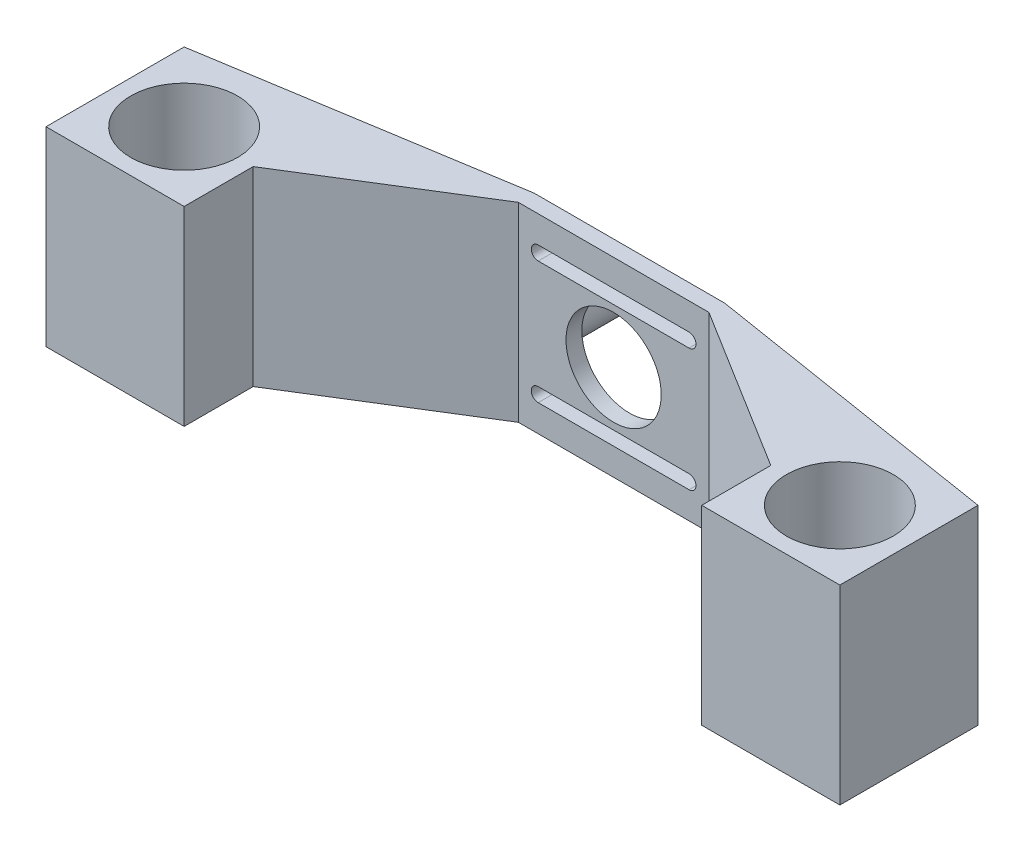
from build123d import *

# Parameters (mm, degrees)
SKETCH2_R           = 13.45
BOSS_EXTRUDE1_DEPTH = 48
SKETCH4_R           = 12
CUT_EXTRUDE1_DEPTH  = 48
SKETCH5_R           = 7.1
SKETCH5_R_2         = 4.1
BOSS_EXTRUDE2_DEPTH = 2
BOSS_EXTRUDE3_START = 13
SKETCH6_R           = 7.1
SKETCH6_R_2         = 4.1
BOSS_EXTRUDE3_DEPTH = 13


with BuildPart() as part:
    # Sketch2 → Boss-Extrude1 (new body)
    with BuildSketch(Plane(origin=(0, 0, 0), x_dir=(1, 0, 0), z_dir=(0, 1, 0))):
        Polygon((-17.4, -17.4), (17.4, -17.4), (17.4, 0), (58.6, 25.6), (82.6, 25.6), (82.6, 29.6), (58.6, 29.6), (-17.4, 17.4), align=None)
        Circle(SKETCH2_R, mode=Mode.SUBTRACT)
    boss_extrude1 = extrude(amount=BOSS_EXTRUDE1_DEPTH)

    # Mirror1: Boss-Extrude1 across plane
    add(boss_extrude1.mirror(Plane(origin=(82.6, 0, 0), x_dir=(0, 0, 1), z_dir=(1, 0, 0))))

    # Sketch4 → Cut-Extrude1 (cut)
    with BuildSketch(Plane(origin=(0, 0, -29.6), x_dir=(-1, 0, 0), z_dir=(0, 0, -1))):
        with Locations((-82.6, 24)):
            Circle(SKETCH4_R)
        with BuildLine():
            Line((-101.6, 10.3), (-63.6, 10.3))
            ThreePointArc((-63.6, 10.3), (-61.85, 8.55), (-63.6, 6.8))
            Line((-63.6, 6.8), (-101.6, 6.8))
            ThreePointArc((-101.6, 6.8), (-103.35, 8.55), (-101.6, 10.3))
        make_face()
        with BuildLine():
            Line((-101.6, 37.7), (-63.6, 37.7))
            ThreePointArc((-63.6, 37.7), (-61.85, 39.45), (-63.6, 41.2))
            Line((-63.6, 41.2), (-101.6, 41.2))
            ThreePointArc((-101.6, 41.2), (-103.35, 39.45), (-101.6, 37.7))
        make_face()
    extrude(amount=-CUT_EXTRUDE1_DEPTH, mode=Mode.SUBTRACT)

    # Sketch5 → Boss-Extrude2 (add)
    with BuildSketch(Plane(origin=(0, 0, -29.6), x_dir=(-1, 0, 0), z_dir=(0, 0, -1))):
        with Locations((-62.1, 24)):
            Circle(SKETCH5_R)
        with Locations((-62.1, 24)):
            Circle(SKETCH5_R_2, mode=Mode.SUBTRACT)
    extrude(amount=-BOSS_EXTRUDE2_DEPTH)

    # Sketch6 → Boss-Extrude3 (add)
    with BuildSketch(Plane(origin=(0, 0, -29.6), x_dir=(-1, 0, 0), z_dir=(0, 0, -1)).offset(BOSS_EXTRUDE3_START)):
        with Locations((-62.1, 24)):
            Circle(SKETCH6_R)
        with Locations((-62.1, 24)):
            Circle(SKETCH6_R_2, mode=Mode.SUBTRACT)
    extrude(amount=-BOSS_EXTRUDE3_DEPTH)


solid = part.part
